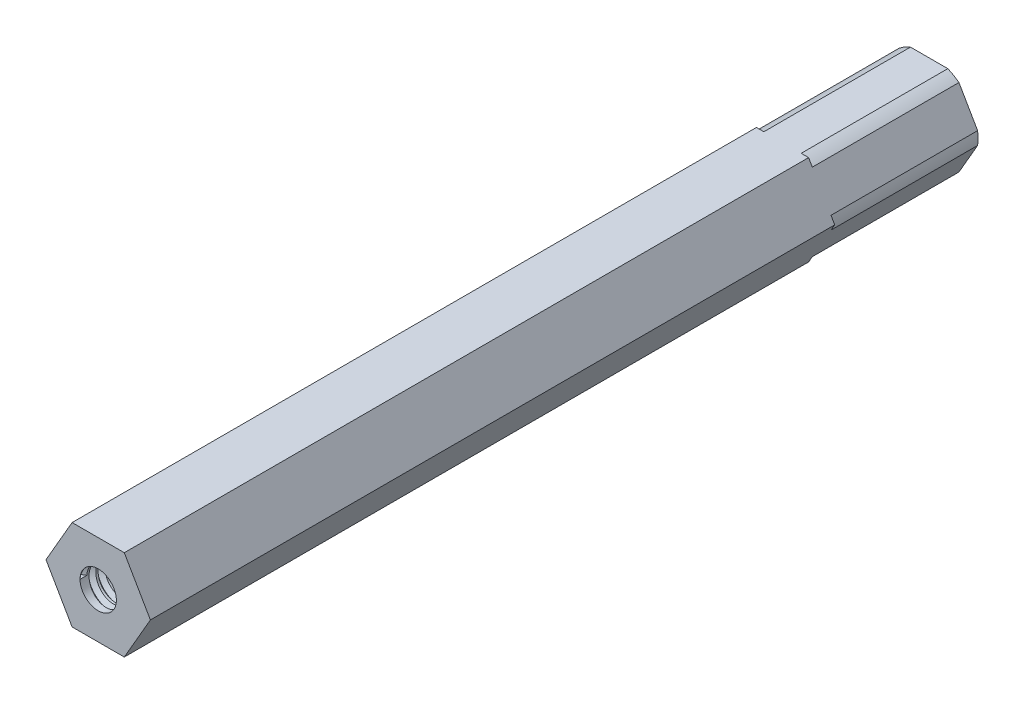
from build123d import *
from build123d.topology import SkipClean

# Parameters (mm, degrees)
EXTRUSI_N_HEX_PROFILE_DEPTH = 58.3692
TAP_START                   = 58.3692
CROQUIS3_R                  = 2.5527
TAP_HOLE_1_DEPTH            = 19.05
TAP_START_2                 = -39.3192
CROQUIS3_3_R                = 2.5527
TAP_HOLE_2_DEPTH            = 19.05
THUNDERHEX_START            = -58.3692
CROQUIS7_OUTSIDE_W          = 40.332
CROQUIS7_OUTSIDE_H          = 38.368
CROQUIS7_OUTSIDE_R          = 6.8707
THUNDERHEX_DEPTH            = 20.5994
ROSCA1_PITCH                = 1.27
ROSCA2_PITCH                = 1.27


with BuildPart() as part:
    # Croquis2 → Extrusión Hex Profile (new, symmetric)
    with BuildSketch(Plane.XY):
        Polygon((3.666174209, -6.35), (7.332348419, 0), (3.666174209, 6.35), (-3.666174209, 6.35), (-7.332348419, 0), (-3.666174209, -6.35), align=None)
    extrude(amount=EXTRUSI_N_HEX_PROFILE_DEPTH, both=True)

    # Croquis3 → Tap Hole 1 (cut)
    with BuildSketch(Plane.XY.offset(TAP_START)):
        Circle(CROQUIS3_R)
    extrude(amount=-TAP_HOLE_1_DEPTH, mode=Mode.SUBTRACT)

    # Croquis3<3> → Tap Hole 2 (cut)
    with BuildSketch(Plane.XY.offset(TAP_START_2)):
        Circle(CROQUIS3_3_R)
    extrude(amount=-TAP_HOLE_2_DEPTH, mode=Mode.SUBTRACT)

    # Croquis7 outside → ThunderHex (cut)
    with BuildSketch(Plane.XY.offset(THUNDERHEX_START)):
        Rectangle(CROQUIS7_OUTSIDE_W, CROQUIS7_OUTSIDE_H)
        Circle(CROQUIS7_OUTSIDE_R, mode=Mode.SUBTRACT)
    extrude(amount=THUNDERHEX_DEPTH, mode=Mode.SUBTRACT)

    # Rosca1: the profile of Perfil de rosca1 profile screwed along a right-hand helix of 15 turns, 8 arcs to a turn; built about Z, then put on its axis
    with SkipClean():  # the faces are left unmerged after this step: merging them gives an invalid solid
        rosca1_z = Axis((0, 0, 0), (0, 0, 1))
        rosca1_corners = [(2.5524, 0, -0.000173205), (3.240107661, 0, 0.396874998), (3.240107661, 0, 0.555624998), (2.5524, 0, 0.952673202)]
        with BuildLine(mode=Mode.PRIVATE) as rosca1_profile:
            Line(rosca1_corners[0], rosca1_corners[1])
            Line(rosca1_corners[1], rosca1_corners[2])
            Line(rosca1_corners[2], rosca1_corners[3])
            Line(rosca1_corners[3], rosca1_corners[0])
        rosca1_cap = Face(rosca1_profile.wire())
        rosca1_turn_angles = [0, 22.5, 45, 67.5, 90, 112.5, 135, 157.5, 180, 202.5, 225, 247.5, 270, 292.5, 315, 337.5, 360]
        rosca1_turn_weights = [1, 0.9238795325112867, 1, 0.9238795325112867, 1, 0.9238795325112867, 1, 0.9238795325112867, 1, 0.9238795325112867, 1, 0.9238795325112867, 1, 0.9238795325112867, 1, 0.9238795325112867, 1]
        rosca1_turn_rails = [Edge.make_bspline([Vector(p[0], p[1], 0).rotate(rosca1_z, rosca1_turn_angles[k]) / rosca1_turn_weights[k] + Vector(0, 0, p[2] + ROSCA1_PITCH * rosca1_turn_angles[k] / 360) for k in range(17)], [0, 0, 0, 1, 1, 2, 2, 3, 3, 4, 4, 5, 5, 6, 6, 7, 7, 8, 8, 8], 2, rosca1_turn_weights) for p in rosca1_corners]
        rosca1_turn_sides = [Face.make_surface_from_curves(rosca1_turn_rails[p[0]], rosca1_turn_rails[p[1]]) for p in [(0, 1), (1, 2), (2, 3), (3, 0)]]
        rosca1 = Plane(origin=(0, 0, 58.3692), x_dir=(-1, 0, 0), z_dir=(0, 0, -1)) * Solid(Shell([*[p.moved(Location((0, 0, ROSCA1_PITCH * i))) for i in range(15) for p in rosca1_turn_sides], rosca1_cap, rosca1_cap.rotate(rosca1_z, 5400).moved(Location((0, 0, ROSCA1_PITCH * 5400 / 360)))]))
        add(rosca1, mode=Mode.SUBTRACT)

    # Rosca2: the profile of Perfil de rosca2 profile screwed along a right-hand helix of 15 turns, 8 arcs to a turn; built about Z, then put on its axis
    with SkipClean():  # the faces are left unmerged after this step: merging them gives an invalid solid
        rosca2_z = Axis((0, 0, 0), (0, 0, 1))
        rosca2_corners = [(2.5524, 0, -0.000173205), (3.240107661, 0, 0.396874998), (3.240107661, 0, 0.555624998), (2.5524, 0, 0.952673202)]
        with BuildLine(mode=Mode.PRIVATE) as rosca2_profile:
            Line(rosca2_corners[0], rosca2_corners[1])
            Line(rosca2_corners[1], rosca2_corners[2])
            Line(rosca2_corners[2], rosca2_corners[3])
            Line(rosca2_corners[3], rosca2_corners[0])
        rosca2_cap = Face(rosca2_profile.wire())
        rosca2_turn_angles = [0, 22.5, 45, 67.5, 90, 112.5, 135, 157.5, 180, 202.5, 225, 247.5, 270, 292.5, 315, 337.5, 360]
        rosca2_turn_weights = [1, 0.9238795325112867, 1, 0.9238795325112867, 1, 0.9238795325112867, 1, 0.9238795325112867, 1, 0.9238795325112867, 1, 0.9238795325112867, 1, 0.9238795325112867, 1, 0.9238795325112867, 1]
        rosca2_turn_rails = [Edge.make_bspline([Vector(p[0], p[1], 0).rotate(rosca2_z, rosca2_turn_angles[k]) / rosca2_turn_weights[k] + Vector(0, 0, p[2] + ROSCA2_PITCH * rosca2_turn_angles[k] / 360) for k in range(17)], [0, 0, 0, 1, 1, 2, 2, 3, 3, 4, 4, 5, 5, 6, 6, 7, 7, 8, 8, 8], 2, rosca2_turn_weights) for p in rosca2_corners]
        rosca2_turn_sides = [Face.make_surface_from_curves(rosca2_turn_rails[p[0]], rosca2_turn_rails[p[1]]) for p in [(0, 1), (1, 2), (2, 3), (3, 0)]]
        rosca2 = Plane(origin=(0, 0, -58.3692), x_dir=(1, 0, 0), z_dir=(0, 0, 1)) * Solid(Shell([*[p.moved(Location((0, 0, ROSCA2_PITCH * i))) for i in range(15) for p in rosca2_turn_sides], rosca2_cap, rosca2_cap.rotate(rosca2_z, 5400).moved(Location((0, 0, ROSCA2_PITCH * 5400 / 360)))]))
        add(rosca2, mode=Mode.SUBTRACT)


solid = part.part
